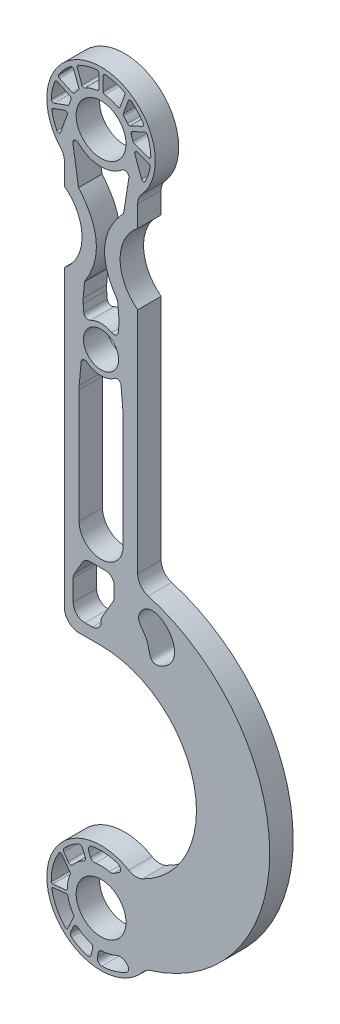
from build123d import *

# Parameters (mm, degrees)
BOSS_EXTRUDE1_OUTLINE_R   = 8.5
BOSS_EXTRUDE1_OUTLINE_R_2 = 6
BOSS_EXTRUDE1_DEPTH       = 8
CUT_EXTRUDE1_DEPTH        = 256.200871332
FILLET1_R                 = 5


# Read off the part's stored shape, not the designer's step: Boss-Extrude1
with BuildPart() as part:
    # Boss-Extrude1 outline → Boss-Extrude1 (new body)
    with BuildSketch(Plane.XY):
        with BuildLine():
            ThreePointArc((11.444366088, -215.464647068), (-18.29086587, -232.773846738), (15.239317045, -240.488718511))
            ThreePointArc((15.239317045, -240.488718511), (57.52601951, -183.58870793), (12.5, -128.830749818))
            Line((12.5, -128.830749818), (12.5, -47))
            ThreePointArc((12.5, -47), (6.5, -35), (12.5, -23))
            Line((12.5, -23), (12.5, -13.638181697))
            ThreePointArc((12.5, -13.638181697), (0, 18.5), (-12.5, -13.638181697))
            Line((-12.5, -13.638181697), (-12.5, -23))
            ThreePointArc((-12.5, -23), (-6.5, -35), (-12.5, -47))
            Line((-12.5, -47), (-12.5, -152.456671403))
            Line((-12.5, -152.456671403), (0, -152.456671403))
            ThreePointArc((0, -152.456671403), (32.019441409, -179.184193262), (11.444366088, -215.464647068))
        make_face()
        with Locations((0, -230)):
            Circle(BOSS_EXTRUDE1_OUTLINE_R, mode=Mode.SUBTRACT)
        with BuildLine():
            Line((0, -145.26051898), (0, -145.456671403))
            ThreePointArc((0, -145.456671403), (-0.878679656, -147.577991747), (-3, -148.456671403))
            Line((-3, -148.456671403), (-5.5, -148.456671403))
            ThreePointArc((-5.5, -148.456671403), (-8.328427125, -147.285098528), (-9.5, -144.456671403))
            Line((-9.5, -144.456671403), (-9.5, -137.26051898))
            ThreePointArc((-9.5, -137.26051898), (-9.397777479, -136.484061845), (-9.098076211, -135.76051898))
            Line((-9.098076211, -135.76051898), (-6.366025404, -131.028468173))
            ThreePointArc((-6.366025404, -131.028468173), (-5.267949192, -129.930391962), (-3.767949192, -129.528468173))
            Line((-3.767949192, -129.528468173), (1.5, -129.528468173))
            ThreePointArc((1.5, -129.528468173), (3.621320344, -130.407147829), (4.5, -132.528468173))
            Line((4.5, -132.528468173), (4.5, -135.858595192))
            ThreePointArc((4.5, -135.858595192), (4.397777479, -136.635052327), (4.098076211, -137.358595192))
            Line((4.098076211, -137.358595192), (0.401923789, -143.76051898))
            ThreePointArc((0.401923789, -143.76051898), (0.102222521, -144.484061845), (0, -145.26051898))
        make_face(mode=Mode.SUBTRACT)
        with BuildLine():
            add(Edge.make_bspline(
                [(12.815143019, -137.878749683), (12.866993457, -139.570347571), (16.491087036, -142.280223186), (16.310410408, -150.377955965), (25.73453143, -146.267961626), (25.451879626, -136.604366128), (16.250652389, -131.320333814), (12.769637961, -136.394167023), (12.815143019, -137.878749683)],
                knots=[0, 0, 0, 0, 0.137048811, 0.2897108, 0.433708709, 0.660987574, 0.879723018, 1, 1, 1, 1], degree=3))
        make_face(mode=Mode.SUBTRACT)
        with BuildLine():
            Line((-7.442920471, -79.347578002), (-6.805813949, -72.065417124))
            ThreePointArc((-6.805813949, -72.065417124), (-6.034209722, -70.988761075), (-4.719159836, -71.147522301))
            ThreePointArc((-4.719159836, -71.147522301), (0, -72.75), (4.719159836, -71.147522301))
            ThreePointArc((4.719159836, -71.147522301), (6.034209722, -70.988761075), (6.805813949, -72.065417124))
            Line((6.805813949, -72.065417124), (7.442920471, -79.347578002))
            ThreePointArc((7.442920471, -79.347578002), (7.485723324, -80.000623333), (7.5, -80.654914144))
            Line((7.5, -80.654914144), (7.5, -119.456671403))
            ThreePointArc((7.5, -119.456671403), (0, -126.956671403), (-7.5, -119.456671403))
            Line((-7.5, -119.456671403), (-7.5, -80.654914144))
            ThreePointArc((-7.5, -80.654914144), (-7.485723324, -80.000623333), (-7.442920471, -79.347578002))
        make_face(mode=Mode.SUBTRACT)
        with Locations((0, -65)):
            Circle(BOSS_EXTRUDE1_OUTLINE_R_2, mode=Mode.SUBTRACT)
        with BuildLine():
            add(Edge.make_bspline(
                [(5.648127088, -47.738954624), (-4.174062702, -33.842492349), (7.673926753, -21)],
                knots=[0, 0, 0, 1, 1, 1], degree=2))
            Line((5.648127088, -47.738954624), (6.09481015, -52.844565385))
            ThreePointArc((6.09481015, -52.844565385), (6.132863169, -53.716122812), (6.09481015, -54.58768024))
            Line((6.09481015, -54.58768024), (5.884715734, -56.989070402))
            ThreePointArc((5.884715734, -56.989070402), (5.102294219, -58.178655062), (3.678463089, -58.178606498))
            ThreePointArc((3.678463089, -58.178606498), (0, -57.25), (-3.678463089, -58.178606498))
            ThreePointArc((-3.678463089, -58.178606498), (-5.102294219, -58.178655062), (-5.884715734, -56.989070402))
            Line((-5.884715734, -56.989070402), (-6.09481015, -54.58768024))
            ThreePointArc((-6.09481015, -54.58768024), (-6.132863169, -53.716122813), (-6.09481015, -52.844565385))
            Line((-6.09481015, -52.844565385), (-5.648127088, -47.738954624))
            add(Edge.make_bspline(
                [(-5.648127088, -47.738954624), (3.370907916, -33.859111383), (-7.673926753, -21)],
                knots=[0, 0, 0, 1, 1, 1], degree=2))
            Line((-7.673926753, -21), (-9.612953986, -8.757463875))
            ThreePointArc((-9.612953986, -8.757463875), (-9.027572093, -7.606139538), (-7.751360737, -7.80489633))
            ThreePointArc((-7.751360737, -7.80489633), (-0.388626311, -10.993132838), (7.180866017, -8.332776443))
            ThreePointArc((7.180866017, -8.332776443), (8.776160312, -8.170306916), (9.477558096, -9.612319878))
            Line((9.477558096, -9.612319878), (7.673926753, -21))
        make_face(mode=Mode.SUBTRACT)
        with BuildLine():
            ThreePointArc((-13.815819109, -7.73639942), (-14.428534406, -8.19553291), (-15.095169757, -7.818941744))
            ThreePointArc((-15.095169757, -7.818941744), (-16.142337475, -5.331504557), (-16.782656624, -2.709693088))
            ThreePointArc((-16.782656624, -2.709693088), (-16.695278148, -2.243744795), (-16.331020158, -1.940332656))
            Line((-16.331020158, -1.940332656), (-12.41062413, -0.513425195))
            ThreePointArc((-12.41062413, -0.513425195), (-11.676235283, -0.676235283), (-11.513425195, -1.41062413))
            Line((-11.513425195, -1.41062413), (-13.815819109, -7.73639942))
        make_face(mode=Mode.SUBTRACT)
        with BuildLine():
            ThreePointArc((-16.055325896, -0.243721492), (-16.703494721, -0.154196787), (-16.994514107, 0.431845204))
            ThreePointArc((-16.994514107, 0.431845204), (-16.65249891, 3.419690051), (-15.789347435, 6.300516452))
            ThreePointArc((-15.789347435, 6.300516452), (-15.397147551, 6.691822959), (-14.843365052, 6.675498873))
            Line((-14.843365052, 6.675498873), (-10.625129371, 4.708503271))
            ThreePointArc((-10.625129371, 4.708503271), (-10.278465342, 4.351932823), (-10.256089691, 3.855125251))
            Line((-10.256089691, 3.855125251), (-10.893744246, 1.918908676))
            ThreePointArc((-10.893744246, 1.918908676), (-11.056048513, 1.650608269), (-11.31920261, 1.48008641))
            Line((-11.31920261, 1.48008641), (-16.055325896, -0.243721492))
        make_face(mode=Mode.SUBTRACT)
        with BuildLine():
            ThreePointArc((-14.124081329, 7.995158243), (-14.499364019, 8.430566103), (-14.422099711, 9.000168884))
            ThreePointArc((-14.422099711, 9.000168884), (-12.600334129, 11.41190518), (-10.380271471, 13.462910688))
            ThreePointArc((-10.380271471, 13.462910688), (-9.757749538, 13.580817681), (-9.295063694, 13.147969642))
            Line((-9.295063694, 13.147969642), (-7.609901039, 8.518023301))
            ThreePointArc((-7.609901039, 8.518023301), (-7.584328716, 8.126875897), (-7.773038001, 7.783307795))
            ThreePointArc((-7.773038001, 7.783307795), (-8.440915114, 7.053435477), (-9.040513356, 6.266507661))
            ThreePointArc((-9.040513356, 6.266507661), (-9.433041522, 5.989569146), (-9.911651534, 6.03086997))
            Line((-9.911651534, 6.03086997), (-14.124081329, 7.995158243))
        make_face(mode=Mode.SUBTRACT)
        Circle(BOSS_EXTRUDE1_OUTLINE_R, mode=Mode.SUBTRACT)
        with BuildLine():
            ThreePointArc((-1.363247863, 10.915198361), (-3.503879738, 10.42702387), (-5.504917648, 9.523438543))
            ThreePointArc((-5.504917648, 9.523438543), (-6.094474876, 9.471628924), (-6.513015424, 9.890061441))
            Line((-6.513015424, 9.890061441), (-8.103729904, 14.260513555))
            ThreePointArc((-8.103729904, 14.260513555), (-8.097642283, 14.755448186), (-7.765709582, 15.122623935))
            ThreePointArc((-7.765709582, 15.122623935), (-4.726439667, 16.329751011), (-1.512269939, 16.932602861))
            ThreePointArc((-1.512269939, 16.932602861), (-0.977553684, 16.751899555), (-0.75, 16.235378037))
            Line((-0.75, 16.235378037), (-0.75, 11.609801893))
            ThreePointArc((-0.75, 11.609801893), (-0.925249347, 11.146512834), (-1.363247863, 10.915198361))
        make_face(mode=Mode.SUBTRACT)
        with BuildLine():
            ThreePointArc((1.512269939, 16.932602861), (4.726439667, 16.329751011), (7.765709582, 15.122623935))
            ThreePointArc((7.765709582, 15.122623935), (8.097642283, 14.755448186), (8.103729904, 14.260513555))
            Line((8.103729904, 14.260513555), (6.513015424, 9.890061441))
            ThreePointArc((6.513015424, 9.890061441), (6.094474876, 9.471628924), (5.504917648, 9.523438543))
            ThreePointArc((5.504917648, 9.523438543), (3.503879738, 10.42702387), (1.363247863, 10.915198361))
            ThreePointArc((1.363247863, 10.915198361), (0.925249347, 11.146512834), (0.75, 11.609801893))
            Line((0.75, 11.609801893), (0.75, 16.235378037))
            ThreePointArc((0.75, 16.235378037), (0.977553684, 16.751899555), (1.512269939, 16.932602861))
        make_face(mode=Mode.SUBTRACT)
        with BuildLine():
            Line((13.815819109, -7.73639942), (11.513425195, -1.41062413))
            ThreePointArc((11.513425195, -1.41062413), (11.676235283, -0.676235283), (12.41062413, -0.513425195))
            Line((12.41062413, -0.513425195), (16.331020158, -1.940332656))
            ThreePointArc((16.331020158, -1.940332656), (16.695278148, -2.243744795), (16.782656624, -2.709693088))
            ThreePointArc((16.782656624, -2.709693088), (16.142337475, -5.331504557), (15.095169757, -7.818941744))
            ThreePointArc((15.095169757, -7.818941744), (14.428534406, -8.19553291), (13.815819109, -7.73639942))
        make_face(mode=Mode.SUBTRACT)
        with BuildLine():
            Line((7.609901039, 8.518023301), (9.295063694, 13.147969642))
            ThreePointArc((9.295063694, 13.147969642), (9.757749538, 13.580817681), (10.380271471, 13.462910688))
            ThreePointArc((10.380271471, 13.462910688), (12.600334129, 11.41190518), (14.422099711, 9.000168884))
            ThreePointArc((14.422099711, 9.000168884), (14.499364019, 8.430566103), (14.124081329, 7.995158243))
            Line((14.124081329, 7.995158243), (9.911651534, 6.03086997))
            ThreePointArc((9.911651534, 6.03086997), (9.433041522, 5.989569146), (9.040513356, 6.266507661))
            ThreePointArc((9.040513356, 6.266507661), (8.440915114, 7.053435477), (7.773038001, 7.783307795))
            ThreePointArc((7.773038001, 7.783307795), (7.584328716, 8.126875897), (7.609901039, 8.518023301))
        make_face(mode=Mode.SUBTRACT)
        with BuildLine():
            ThreePointArc((11.31920261, 1.48008641), (11.056048513, 1.650608269), (10.893744246, 1.918908676))
            Line((10.893744246, 1.918908676), (10.256089691, 3.855125251))
            ThreePointArc((10.256089691, 3.855125251), (10.278465342, 4.351932823), (10.625129371, 4.708503271))
            Line((10.625129371, 4.708503271), (14.843365052, 6.675498873))
            ThreePointArc((14.843365052, 6.675498873), (15.397147551, 6.691822959), (15.789347435, 6.300516452))
            ThreePointArc((15.789347435, 6.300516452), (16.65249891, 3.419690051), (16.994514107, 0.431845204))
            ThreePointArc((16.994514107, 0.431845204), (16.703494721, -0.154196787), (16.055325896, -0.243721492))
            Line((16.055325896, -0.243721492), (11.31920261, 1.48008641))
        make_face(mode=Mode.SUBTRACT)
    extrude(amount=BOSS_EXTRUDE1_DEPTH)

    # Sketch2 → Cut-Extrude1 (cut, through all)
    with BuildSketch(Plane.XY.offset(8)):
        with BuildLine():
            Line((-11.368264394, -241.715074457), (-9.312108775, -237.177397512))
            ThreePointArc((-9.312108775, -237.177397512), (-9.269894815, -236.922506062), (-9.360554006, -236.680570987))
            ThreePointArc((-9.360554006, -236.680570987), (-10.588990051, -234.485898985), (-11.310944869, -232.076662269))
            ThreePointArc((-11.310944869, -232.076662269), (-11.501911036, -231.767563762), (-11.851719008, -231.669358128))
            Line((-11.851719008, -231.669358128), (-16.341416703, -232.111421356))
            ThreePointArc((-16.341416703, -232.111421356), (-16.688357794, -232.303670338), (-16.786132556, -232.688076226))
            ThreePointArc((-16.786132556, -232.688076226), (-15.192344288, -237.628412354), (-12.181983878, -241.857456253))
            ThreePointArc((-12.181983878, -241.857456253), (-11.737511293, -242.001224738), (-11.368264394, -241.715074457))
        make_face()
        with BuildLine():
            Line((8.885005262, -242.185081432), (8.425329017, -241.794188696))
            ThreePointArc((8.425329017, -241.794188696), (6.89051139, -241.107552205), (5.227337982, -241.354511774))
            ThreePointArc((5.227337982, -241.354511774), (2.895886231, -242.159927752), (0.451668908, -242.491837143))
            ThreePointArc((0.451668908, -242.491837143), (-0.475193468, -242.856169939), (-0.969598088, -243.720679235))
            Line((-0.969598088, -243.720679235), (-1.245630786, -245.228117516))
            ThreePointArc((-1.245630786, -245.228117516), (-0.915241093, -246.467211436), (0.25207872, -246.998130965))
            ThreePointArc((0.25207872, -246.998130965), (4.621495743, -246.359760912), (8.679092589, -244.61756997))
            ThreePointArc((8.679092589, -244.61756997), (9.407944666, -243.454308423), (8.885005262, -242.185081432))
        make_face()
        with BuildLine():
            Line((-2.840165043, -243.163511092), (-3.37713924, -245.610557078))
            ThreePointArc((-3.37713924, -245.610557078), (-3.840110969, -246.254136457), (-4.626017491, -246.358482881))
            ThreePointArc((-4.626017491, -246.358482881), (-7.478400223, -245.266745891), (-10.089404601, -243.682248163))
            ThreePointArc((-10.089404601, -243.682248163), (-10.459030669, -243.146480636), (-10.42061123, -242.496715894))
            Line((-10.42061123, -242.496715894), (-9.433876852, -240.099951191))
            ThreePointArc((-9.433876852, -240.099951191), (-8.755755112, -239.511522709), (-7.878866514, -239.704301234))
            ThreePointArc((-7.878866514, -239.704301234), (-5.819840034, -241.062525118), (-3.534189461, -241.989975182))
            ThreePointArc((-3.534189461, -241.989975182), (-2.956181696, -242.440133294), (-2.840165043, -243.163511092))
        make_face()
        with BuildLine():
            Line((-3.626958395, -216.73190549), (-4.191689976, -215.307250282))
            ThreePointArc((-4.191689976, -215.307250282), (-4.109308543, -214.027514219), (-3.067951668, -213.279124647))
            ThreePointArc((-3.067951668, -213.279124647), (1.342061364, -213.05305717), (5.661523233, -213.970428743))
            ThreePointArc((5.661523233, -213.970428743), (6.603252912, -214.969201985), (6.337896277, -216.316045937))
            Line((6.337896277, -216.316045937), (4.298415432, -217.571887175))
            ThreePointArc((4.298415432, -217.571887175), (3.574200581, -217.842367458), (2.801509106, -217.817982649))
            ThreePointArc((2.801509106, -217.817982649), (0.411746832, -217.506783259), (-1.993320062, -217.659956437))
            ThreePointArc((-1.993320062, -217.659956437), (-2.97344045, -217.483388388), (-3.626958395, -216.73190549))
        make_face()
        with BuildLine():
            Line((-5.352938454, -217.643195734), (-6.356854745, -215.347868432))
            ThreePointArc((-6.356854745, -215.347868432), (-6.936454875, -214.806942442), (-7.7276204, -214.857877198))
            ThreePointArc((-7.7276204, -214.857877198), (-10.312303842, -216.484956919), (-12.564139767, -218.548258127))
            ThreePointArc((-12.564139767, -218.548258127), (-12.822175683, -219.145826315), (-12.657768715, -219.775620426))
            Line((-12.657768715, -219.775620426), (-11.222535586, -221.933914112))
            ThreePointArc((-11.222535586, -221.933914112), (-10.442673244, -222.378787015), (-9.620221845, -222.0186886))
            ThreePointArc((-9.620221845, -222.0186886), (-7.865633277, -220.28496973), (-5.804757595, -218.92955334))
            ThreePointArc((-5.804757595, -218.92955334), (-5.325644958, -218.375309365), (-5.352938454, -217.643195734))
        make_face()
        with BuildLine():
            Line((-13.434778309, -220.727075075), (-10.53311261, -224.776596548))
            ThreePointArc((-10.53311261, -224.776596548), (-10.441997153, -225.018360158), (-10.483730167, -225.273330794))
            ThreePointArc((-10.483730167, -225.273330794), (-11.260543676, -227.665443058), (-11.498754924, -230.169219349))
            ThreePointArc((-11.498754924, -230.169219349), (-11.625769638, -230.509626791), (-11.949706863, -230.674170517))
            Line((-11.949706863, -230.674170517), (-16.439404558, -231.116233745))
            ThreePointArc((-16.439404558, -231.116233745), (-16.817178075, -230.995341389), (-16.988046925, -230.637386605))
            ThreePointArc((-16.988046925, -230.637386605), (-16.388391149, -225.481080267), (-14.260640834, -220.746129296))
            ThreePointArc((-14.260640834, -220.746129296), (-13.852743104, -220.518434989), (-13.434778309, -220.727075075))
        make_face()
    extrude(amount=-CUT_EXTRUDE1_DEPTH, mode=Mode.SUBTRACT)

    # Fillet1
    fillet1_edges = [part.edges().sort_by_distance(p)[0] for p in [
        (11.444366088, -215.464647068, 4),
        (-12.5, -152.456671403, 4),
        (-12.5, -13.638181697, 4),
        (12.5, -13.638181697, 4),
        (12.5, -128.830749818, 4),
        (15.239317045, -240.488718511, 4),
    ]]
    fillet(fillet1_edges, radius=FILLET1_R)


solid = part.part
